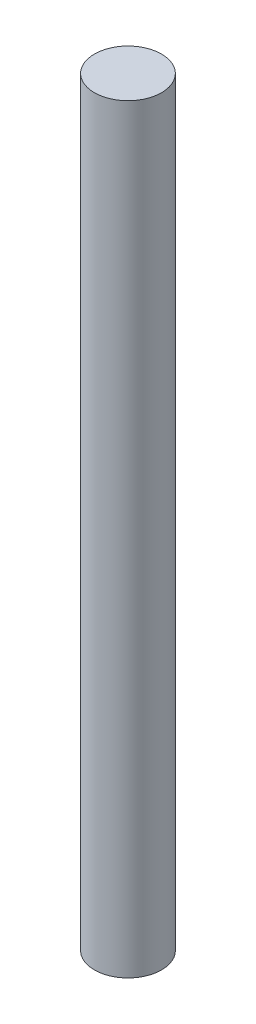
from build123d import *

# Parameters (mm, degrees)
SKETCH1_R           = 1.5
BOSS_EXTRUDE1_DEPTH = 34


with BuildPart() as part:
    # Sketch1 → Boss-Extrude1 (new body)
    with BuildSketch(Plane(origin=(0, 0, 0), x_dir=(1, 0, 0), z_dir=(0, 1, 0))):
        Circle(SKETCH1_R)
    extrude(amount=BOSS_EXTRUDE1_DEPTH)


solid = part.part
